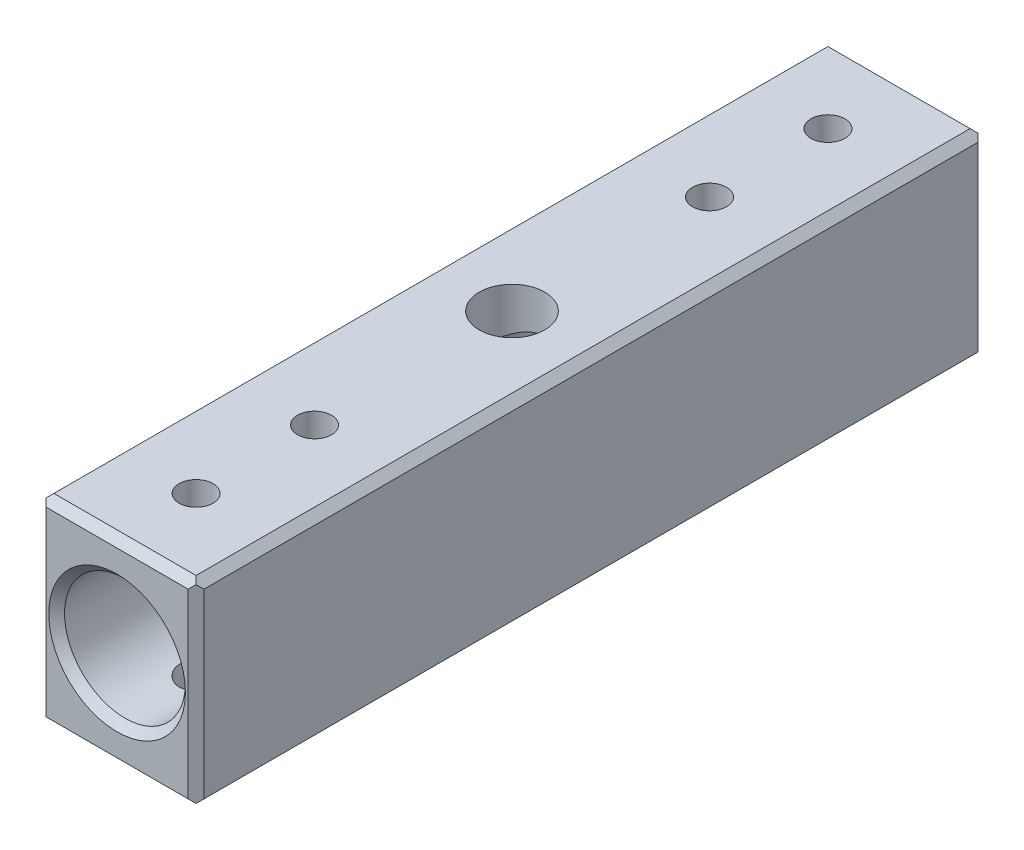
from build123d import *

# Parameters (mm, degrees)
SKETCH_2_W          = 20
SKETCH_2_H          = 25
SKETCH_2_R          = 7.65
EXTRUDE_1_DEPTH     = 100
SKETCH_3_R          = 2.15
SKETCH_3_R_2        = 4.15
CUT_EXTRUDE_2_DEPTH = 104.561575886
CHAMFER_1_SIZE      = 1
CHAMFER_2_SIZE      = 1


with BuildPart() as part:
    # 草图2 → 凸台-拉伸1 (new body)
    with BuildSketch(Plane.XY):
        Rectangle(SKETCH_2_W, SKETCH_2_H)
        Circle(SKETCH_2_R, mode=Mode.SUBTRACT)
    extrude(amount=-EXTRUDE_1_DEPTH)

    # 草图3 → 切除-拉伸2 (cut, through all)
    with BuildSketch(Plane(origin=(0, 12.5, 0), x_dir=(1, 0, 0), z_dir=(0, 1, 0))):
        with Locations((0, 75)):
            Circle(SKETCH_3_R)
        with Locations((0, 50)):
            Circle(SKETCH_3_R_2)
        with Locations((0, 90)):
            Circle(SKETCH_3_R)
        with Locations((0, 10)):
            Circle(SKETCH_3_R)
        with Locations((0, 25)):
            Circle(SKETCH_3_R)
    extrude(amount=-CUT_EXTRUDE_2_DEPTH, mode=Mode.SUBTRACT)

    # 倒角1
    chamfer_1_edges = [part.edges().sort_by_distance(p)[0] for p in [
        (0, 12.5, -100),
        (-10, 0, -100),
        (0, -12.5, -100),
        (10, 0, -100),
        (0, -12.5, 0),
        (-10, 0, 0),
        (0, 12.5, 0),
        (10, 0, 0),
        (-7.65, 0, -100),
        (-7.65, 0, 0),
    ]]
    chamfer(chamfer_1_edges, length=CHAMFER_1_SIZE)

    # 倒角2
    chamfer_2_edges = [part.edges().sort_by_distance(p)[0] for p in [
        (10, -12.5, -50),
        (-10, -12.5, -50),
        (10, 12.5, -50),
        (-10, 12.5, -50),
    ]]
    chamfer(chamfer_2_edges, length=CHAMFER_2_SIZE)


solid = part.part
